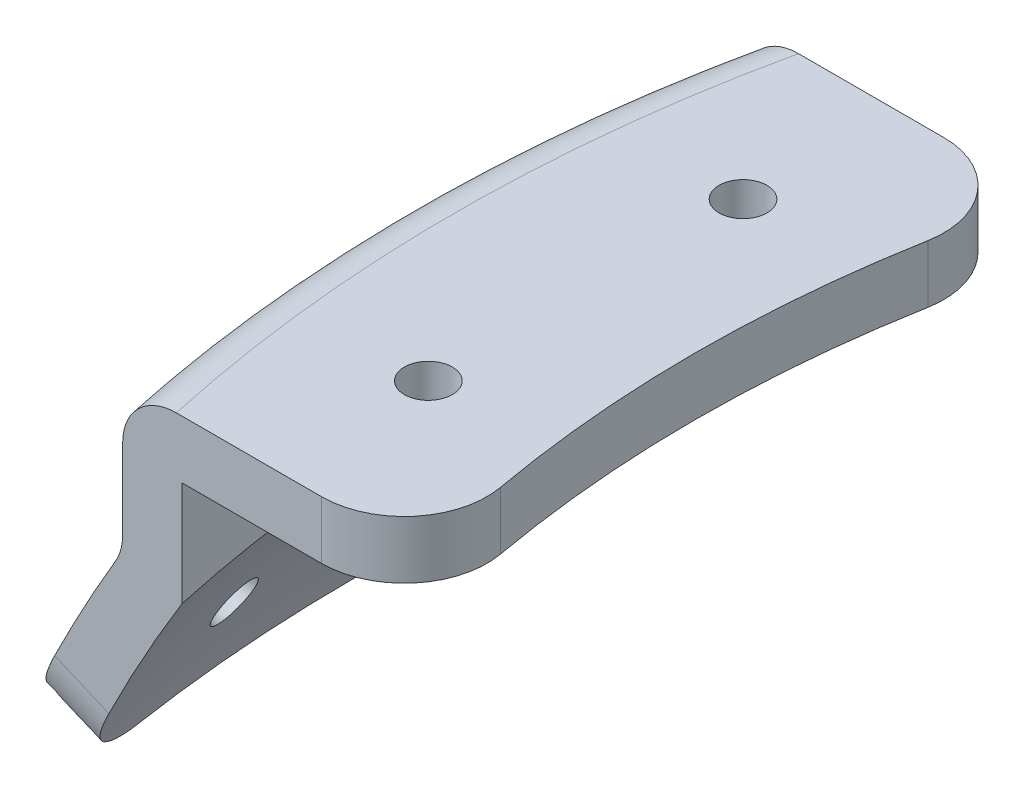
from build123d import *

# Parameters (mm, degrees)
REVOLVE1_ANGLE          = 30
FILLET1_R               = 6.35
CUT_EXTRUDE1_DEPTH      = 203.817555616
CUT_EXTRUDE1_DEPTH_BACK = 203.817555616
SKETCH3_R               = 2.9
SKETCH4_OUTSIDE_W       = 78.705
SKETCH4_OUTSIDE_H       = 126.158
SKETCH4_OUTSIDE_W_2     = 74.859969382
SKETCH4_OUTSIDE_H_2     = 75.329921726
CUT_EXTRUDE2_DEPTH      = 205.212912231
FILLET2_R               = 10


with BuildPart() as part:
    # Sketch2 → Revolve1 (revolve, symmetric)
    with BuildSketch(Plane.XY) as revolve1_sk:
        with BuildLine():
            Line((-193.040570148, 173.070578145), (-186.612006918, 170.300456344))
            ThreePointArc((-186.612006918, 170.300456344), (-180.767698798, 182.695531071), (-174.101233777, 194.668503093))
            Line((-174.101233777, 194.668503093), (-174.101233777, 207.368503093))
            Line((-174.101233777, 207.368503093), (-145.526233777, 207.368503093))
            Line((-145.526233777, 207.368503093), (-145.526233777, 214.368503093))
            Line((-145.526233777, 214.368503093), (-181.101233777, 214.368503093))
            Line((-181.101233777, 214.368503093), (-181.101233777, 196.594774384))
            ThreePointArc((-181.101233777, 196.594774384), (-187.440308667, 185.020162836), (-193.040570148, 173.070578145))
        make_face()
    revolve(axis=Axis((0, 0, 0), (0, 1, 0)), revolution_arc=REVOLVE1_ANGLE / 2)
    revolve(revolve1_sk.sketch, axis=Axis((0, 0, 0), (0, -1, 0)), revolution_arc=REVOLVE1_ANGLE / 2)

    # Fillet1
    fillet1_edges = [part.edges().sort_by_distance(p)[0] for p in [
        (-181.101233777, 196.594774384, 0),
        (-181.101233777, 214.368503093, 0),
    ]]
    fillet(fillet1_edges, radius=FILLET1_R)

    # Sketch3 → Cut-Extrude1 (cut, two sides: drawn at the far end of the back side and taken through both)
    with BuildSketch(Plane.XZ.offset(-207.368503093).offset(-CUT_EXTRUDE1_DEPTH_BACK)):
        with Locations((-158.75, -19.05)):
            Circle(SKETCH3_R)
        with Locations((-158.75, 19.05)):
            Circle(SKETCH3_R)
    extrude(amount=CUT_EXTRUDE1_DEPTH + CUT_EXTRUDE1_DEPTH_BACK, mode=Mode.SUBTRACT)

    # Sketch4 outside → Cut-Extrude2 (cut, through all)
    with BuildSketch(Plane(origin=(0, 214.368503093, 0), x_dir=(1, 0, 0), z_dir=(0, 1, 0))):
        with Locations((-166.8045, 0)):
            Rectangle(SKETCH4_OUTSIDE_W, SKETCH4_OUTSIDE_H)
        with Locations((-177.997532298, 0)):
            Rectangle(SKETCH4_OUTSIDE_W_2, SKETCH4_OUTSIDE_H_2, mode=Mode.SUBTRACT)
    extrude(amount=-CUT_EXTRUDE2_DEPTH, mode=Mode.SUBTRACT)

    # Fillet2
    fillet2_edges = [part.edges().sort_by_distance(p)[0] for p in [
        (-186.05109809, 171.685109276, 37.664960863),
        (-186.05109809, 171.685109276, -37.664960863),
        (-140.567547607, 210.868503093, -37.664960863),
        (-140.567547607, 210.868503093, 37.664960863),
    ]]
    fillet(fillet2_edges, radius=FILLET2_R)

    # Sketch6 → Cut-Revolve1 (revolve, cut)
    with BuildSketch(Plane(origin=(36.360369904, 71.361243959, 0), x_dir=(-0.8910065241883691, 0.4539904997395443, 0), z_dir=(0.4539904997395443, 0.8910065241883691, 0))):
        Polygon((216.837700771, 18.970840643), (271.242197983, 23.730617393), (270.989446329, 26.619582018), (216.584949117, 21.859805267), align=None)
    cut_revolve1 = revolve(axis=Axis((-156.843436173, 169.803500094, 18.970840643), (-0.887615975361608, 0.4522629288245561, 0.08715574274765836)), mode=Mode.SUBTRACT)

    # Mirror1: Cut-Revolve1 across plane
    add(cut_revolve1.mirror(Plane.XY), mode=Mode.SUBTRACT)


solid = part.part
